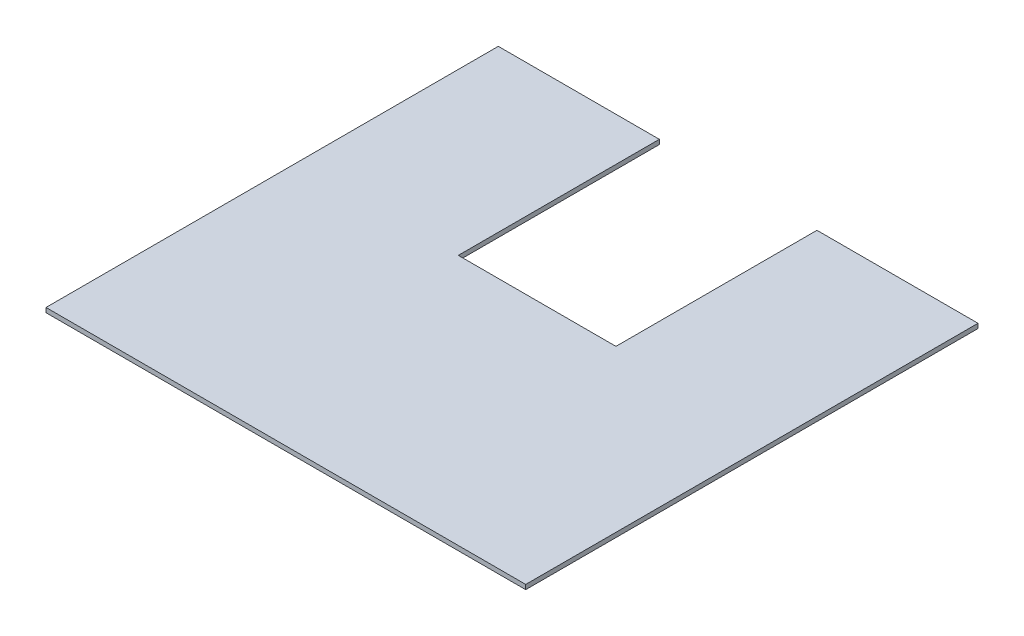
from build123d import *

# Parameters (mm, degrees)
SKETCH1_W           = 210
SKETCH1_H           = 198
BOSS_EXTRUDE1_DEPTH = 1
SKETCH2_W           = 69
SKETCH2_H           = 88
CUT_EXTRUDE1_DEPTH  = 145.32601983


with BuildPart() as part:
    # Sketch1 → Boss-Extrude1 (new, symmetric)
    with BuildSketch(Plane(origin=(0, 0, 0), x_dir=(1, 0, 0), z_dir=(0, 1, 0))):
        Rectangle(SKETCH1_W, SKETCH1_H)
    extrude(amount=BOSS_EXTRUDE1_DEPTH, both=True)

    # Sketch2 → Cut-Extrude1 (cut, through all)
    with BuildSketch(Plane(origin=(0, 1, 0), x_dir=(1, 0, 0), z_dir=(0, 1, 0))):
        with Locations((0, 55)):
            Rectangle(SKETCH2_W, SKETCH2_H)
    extrude(amount=-CUT_EXTRUDE1_DEPTH, mode=Mode.SUBTRACT)


solid = part.part
